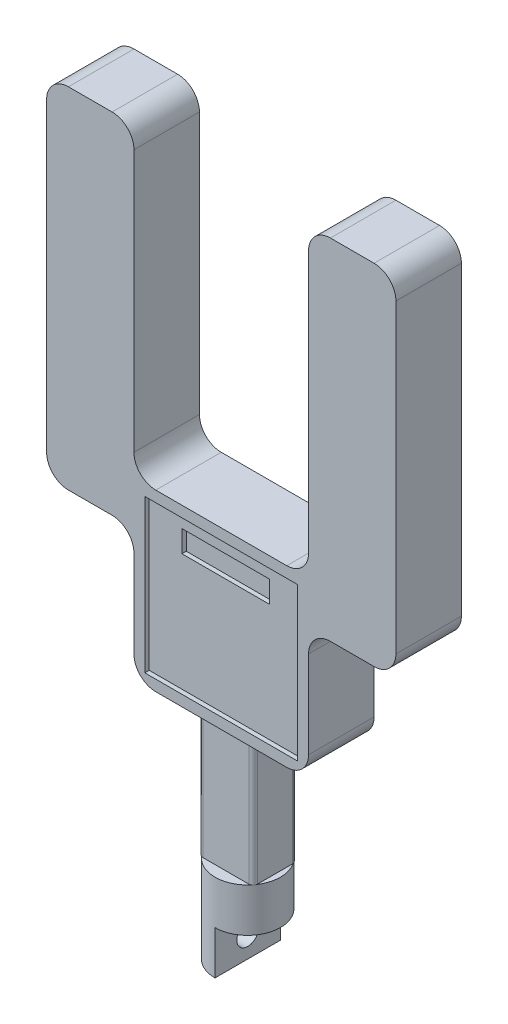
from build123d import *

# Parameters (mm, degrees)
SKETCH1_W           = 101.6
SKETCH1_H           = 101.6
BOSS_EXTRUDE1_DEPTH = 38.1
SKETCH2_W           = 50.8
SKETCH2_H           = 12.7
CUT_EXTRUDE1_DEPTH  = 5.08
SKETCH3_W           = 88.9
SKETCH3_H           = 88.9
CUT_EXTRUDE2_DEPTH  = 2.54
SKETCH4_W           = 31.75
SKETCH4_H           = 25.4
BOSS_EXTRUDE2_DEPTH = 76.2
SKETCH6_R           = 19.05
BOSS_EXTRUDE3_DEPTH = 50.8
SKETCH7_W           = 24.863041021
SKETCH7_H           = 49.917211664
CUT_EXTRUDE3_DEPTH  = 25.4
SKETCH8_W           = 50.8
SKETCH8_H           = 203.2
BOSS_EXTRUDE4_DEPTH = 38.1
FILLET1_R           = 12.7
SKETCH9_R           = 6.35
CUT_EXTRUDE4_DEPTH  = 301.990708903
FILLET2_R           = 2.54


with BuildPart() as part:
    # Sketch1 → Boss-Extrude1 (new body)
    with BuildSketch(Plane.XY):
        with Locations((50.8, 50.8)):
            Rectangle(SKETCH1_W, SKETCH1_H)
    extrude(amount=BOSS_EXTRUDE1_DEPTH)

    # Sketch2 → Cut-Extrude1 (cut)
    with BuildSketch(Plane.XY.offset(38.1)):
        with Locations((50.8, 80.942159742)):
            Rectangle(SKETCH2_W, SKETCH2_H)
    extrude(amount=-CUT_EXTRUDE1_DEPTH, mode=Mode.SUBTRACT)

    # Sketch3 → Cut-Extrude2 (cut)
    with BuildSketch(Plane.XY.offset(38.1)):
        with Locations((50.8, 50.8)):
            Rectangle(SKETCH3_W, SKETCH3_H)
    extrude(amount=-CUT_EXTRUDE2_DEPTH, mode=Mode.SUBTRACT)

    # Sketch4 → Boss-Extrude2 (add)
    with BuildSketch(Plane.XZ):
        with Locations((47.141096121, 19.05)):
            Rectangle(SKETCH4_W, SKETCH4_H)
    extrude(amount=BOSS_EXTRUDE2_DEPTH)

    # Sketch6 → Boss-Extrude3 (add)
    with BuildSketch(Plane.XZ.offset(76.2)):
        with Locations(Location((47.141096121, 19.05, 0), (0, 0, 138.189685104))):
            Circle(SKETCH6_R)
    extrude(amount=BOSS_EXTRUDE3_DEPTH)

    # Sketch7 → Cut-Extrude3 (cut)
    with BuildSketch(Plane.XZ.offset(127)):
        with Locations((59.572616632, 20.72754322)):
            Rectangle(SKETCH7_W, SKETCH7_H)
    extrude(amount=-CUT_EXTRUDE3_DEPTH, mode=Mode.SUBTRACT)

    # Sketch8 → Boss-Extrude4 (add)
    with BuildSketch(Plane(origin=(0, 0, 0), x_dir=(-1, 0, 0), z_dir=(0, 0, -1))):
        with Locations((25.4, 177.8)):
            Rectangle(SKETCH8_W, SKETCH8_H)
        with Locations((-127, 177.8)):
            Rectangle(SKETCH8_W, SKETCH8_H)
    extrude(amount=-BOSS_EXTRUDE4_DEPTH)

    # Fillet1
    fillet1_edges = [part.edges().sort_by_distance(p)[0] for p in [
        (101.6, 0, 19.05),
        (0, 0, 19.05),
        (0, 76.2, 19.05),
        (101.6, 76.2, 19.05),
        (101.6, 101.6, 19.05),
        (0, 101.6, 19.05),
        (152.4, 76.2, 19.05),
        (-50.8, 76.2, 19.05),
        (-50.8, 279.4, 19.05),
        (101.6, 279.4, 19.05),
        (152.4, 279.4, 19.05),
        (0, 279.4, 19.05),
    ]]
    fillet(fillet1_edges, radius=FILLET1_R)

    # Sketch9 → Cut-Extrude4 (cut, through all)
    with BuildSketch(Plane(origin=(47.141096121, 0, 0), x_dir=(0, 0, -1), z_dir=(1, 0, 0))):
        with Locations((-19.05, -114.3)):
            Circle(SKETCH9_R)
    extrude(amount=-CUT_EXTRUDE4_DEPTH, mode=Mode.SUBTRACT)

    # Fillet2
    # the kernel refuses this fillet: 2.54 mm, written as the material it takes off along each edge
    with BuildSketch(Plane(origin=(31.266096121, 0, 31.75), x_dir=(1, 0, 0), z_dir=(0, -1, 0))) as fillet2_piece_1:
        with BuildLine():
            CenterArc((FILLET2_R, -FILLET2_R), FILLET2_R, 90, 90)
            Line((0, -FILLET2_R), (0, 0))
            Line((0, 0), (FILLET2_R, 0))
        make_face()
    extrude(amount=76.2, mode=Mode.SUBTRACT)
    with BuildSketch(Plane(origin=(31.266096121, 0, 6.35), x_dir=(1, 0, 0), z_dir=(0, -1, 0)), Plane(origin=(63.016096121, 0, 6.35), x_dir=(0, 0, 1), z_dir=(0, -1, 0)), Plane(origin=(63.016096121, 0, 31.75), x_dir=(-1, 0, 0), z_dir=(0, -1, 0))) as fillet2_piece_2:
        with BuildLine():
            CenterArc((FILLET2_R, FILLET2_R), FILLET2_R, 180, 90)
            Line((0, FILLET2_R), (0, 0))
            Line((0, 0), (FILLET2_R, 0))
        make_face()
    extrude(amount=76.2, mode=Mode.SUBTRACT)


solid = part.part
